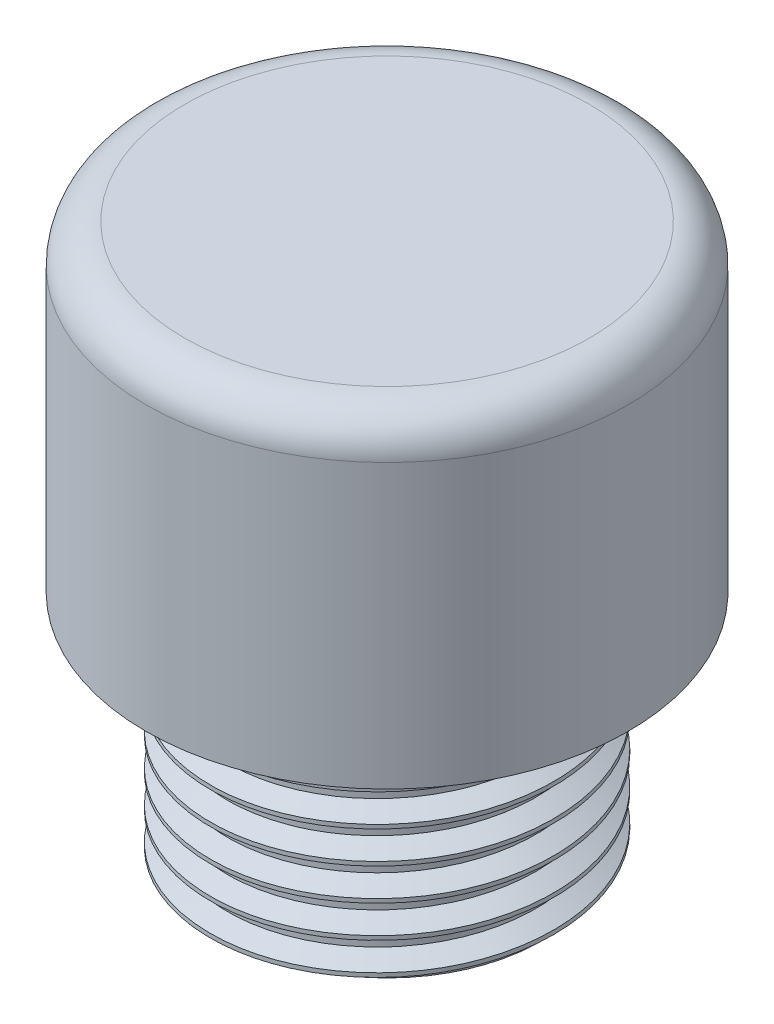
from build123d import *

# Parameters (mm, degrees)
SKETCH1_R           = 9.525
SKETCH1_R_2         = 6.096
SKETCH1_W           = 6.731
SKETCH1_H           = 6.731
BOSS_EXTRUDE1_DEPTH = 12.7
SKETCH1_3_R         = 6.096
SKETCH1_3_W         = 6.731
SKETCH1_3_H         = 6.731
BOSS_EXTRUDE2_DEPTH = 8.89
CUT_EXTRUDE1_START  = 12.192
SKETCH1_5_W         = 6.731
SKETCH1_5_H         = 6.731
CUT_EXTRUDE1_DEPTH  = 6.731
THREAD1_PITCH       = 1.27
THREAD1_FROM        = 6.08
FILLET1_R           = 1.524
SKETCH2_R           = 3.81
CUT_EXTRUDE2_DEPTH  = 8.89
CHAMFER1_SIZE       = 2.54
CHAMFER1_SIZE2      = 3.048


with BuildPart() as part:
    # Sketch1 → Boss-Extrude1 (new body)
    # profile 1 of 3: a face of its own
    with BuildSketch(Plane(origin=(0, 0, 0), x_dir=(1, 0, 0), z_dir=(0, 1, 0))):
        with Locations(Location((0, 0, 0), (0, 0, 270))):
            Circle(SKETCH1_R)
        Circle(SKETCH1_R_2, mode=Mode.SUBTRACT)
    # profile 2 of 3: a face of its own
    with BuildSketch(Plane(origin=(0, 0, 0), x_dir=(1, 0, 0), z_dir=(0, 1, 0))):
        Circle(SKETCH1_R_2)
        Rectangle(SKETCH1_W, SKETCH1_H, mode=Mode.SUBTRACT)
    # profile 3 of 3: a face of its own
    with BuildSketch(Plane(origin=(0, 0, 0), x_dir=(1, 0, 0), z_dir=(0, 1, 0))):
        Rectangle(SKETCH1_W, SKETCH1_H)
    extrude(amount=BOSS_EXTRUDE1_DEPTH)

    # Sketch1<3> → Boss-Extrude2 (add)
    # profile 1 of 2: a face of its own
    with BuildSketch(Plane(origin=(0, 0, 0), x_dir=(1, 0, 0), z_dir=(0, 1, 0))):
        with Locations(Location((0, 0, 0), (0, 0, 270))):
            Circle(SKETCH1_3_R)
        Rectangle(SKETCH1_3_W, SKETCH1_3_H, mode=Mode.SUBTRACT)
    # profile 2 of 2: a face of its own
    with BuildSketch(Plane(origin=(0, 0, 0), x_dir=(1, 0, 0), z_dir=(0, 1, 0))):
        Rectangle(SKETCH1_3_W, SKETCH1_3_H)
    extrude(amount=-BOSS_EXTRUDE2_DEPTH)

    # Sketch1<5> → Cut-Extrude1 (cut)
    with BuildSketch(Plane(origin=(0, 0, 0), x_dir=(1, 0, 0), z_dir=(0, 1, 0)).offset(CUT_EXTRUDE1_START)):
        Rectangle(SKETCH1_5_W, SKETCH1_5_H)
    extrude(amount=-CUT_EXTRUDE1_DEPTH, mode=Mode.SUBTRACT)

    # Thread1: arcs per turn and ends read off the stored shape
    # Thread1: the profile of Thread Profile2 profile screwed along a right-hand helix through 11.787402 turns, 8 arcs to a turn; built about Z, then put on its axis
    thread1_z = Axis((0, 0, 0), (0, 0, 1))
    thread1_corners = [(6.0957, 0, -0.000173205), (6.783407661, 0, 0.396874998), (6.783407661, 0, 0.555624998), (6.0957, 0, 0.952673202)]
    with BuildLine(mode=Mode.PRIVATE) as thread1_profile:
        Line(thread1_corners[0], thread1_corners[1])
        Line(thread1_corners[1], thread1_corners[2])
        Line(thread1_corners[2], thread1_corners[3])
        Line(thread1_corners[3], thread1_corners[0])
    thread1_cap = Face(thread1_profile.wire())
    thread1_turn_angles = [0, 22.5, 45, 67.5, 90, 112.5, 135, 157.5, 180, 202.5, 225, 247.5, 270, 292.5, 315, 337.5, 360]
    thread1_turn_weights = [1, 0.9238795325112867, 1, 0.9238795325112867, 1, 0.9238795325112867, 1, 0.9238795325112867, 1, 0.9238795325112867, 1, 0.9238795325112867, 1, 0.9238795325112867, 1, 0.9238795325112867, 1]
    thread1_turn_rails = [Edge.make_bspline([Vector(p[0], p[1], 0).rotate(thread1_z, thread1_turn_angles[k]) / thread1_turn_weights[k] + Vector(0, 0, p[2] + THREAD1_PITCH * thread1_turn_angles[k] / 360) for k in range(17)], [0, 0, 0, 1, 1, 2, 2, 3, 3, 4, 4, 5, 5, 6, 6, 7, 7, 8, 8, 8], 2, thread1_turn_weights) for p in thread1_corners]
    thread1_turn_sides = [Face.make_surface_from_curves(thread1_turn_rails[p[0]], thread1_turn_rails[p[1]]) for p in [(0, 1), (1, 2), (2, 3), (3, 0)]]
    thread1_last_angles = [3960, 3982.5, 4005, 4027.5, 4050, 4072.5, 4095, 4117.5, 4140, 4162.5, 4185, 4207.5, 4230, 4236.732283465, 4243.464566929]
    thread1_last_weights = [1, 0.9238795325112867, 1, 0.9238795325112867, 1, 0.9238795325112867, 1, 0.9238795325112867, 1, 0.9238795325112867, 1, 0.9238795325112867, 1, 0.9931047534388159, 1]
    thread1_last_rails = [Edge.make_bspline([Vector(p[0], p[1], 0).rotate(thread1_z, thread1_last_angles[k]) / thread1_last_weights[k] + Vector(0, 0, p[2] + THREAD1_PITCH * thread1_last_angles[k] / 360) for k in range(15)], [0, 0, 0, 1, 1, 2, 2, 3, 3, 4, 4, 5, 5, 6, 6, 7, 7, 7], 2, thread1_last_weights) for p in thread1_corners]
    thread1_last_sides = [Face.make_surface_from_curves(thread1_last_rails[p[0]], thread1_last_rails[p[1]]) for p in [(0, 1), (1, 2), (2, 3), (3, 0)]]
    thread1 = Plane(origin=(0, -14.97, 0), x_dir=(1, 0, 0), z_dir=(0, 1, 0)) * split(Solid(Shell([*[p.moved(Location((0, 0, THREAD1_PITCH * i))) for i in range(11) for p in thread1_turn_sides], *thread1_last_sides, thread1_cap, thread1_cap.rotate(thread1_z, 4243.464566929).moved(Location((0, 0, THREAD1_PITCH * 4243.464566929 / 360)))])), bisect_by=Plane.XY.offset(THREAD1_FROM), keep=Keep.TOP, mode=Mode.PRIVATE)
    add(thread1)

    # Fillet1
    fillet1_edges = [part.edges().sort_by_distance(p)[0] for p in [
        (0, 12.7, -9.525),
    ]]
    fillet(fillet1_edges, radius=FILLET1_R)

    # Sketch2 → Cut-Extrude2 (cut)
    with BuildSketch(Plane.XZ):
        with Locations(Location((0, 0, 0), (0, 0, 90))):
            Circle(SKETCH2_R)
    extrude(amount=CUT_EXTRUDE2_DEPTH, mode=Mode.SUBTRACT)

    # Chamfer1
    chamfer1_edges = [part.edges().sort_by_distance(p)[0] for p in [
        (0, 0, -3.81),
    ]]
    chamfer1_side = [part.faces().sort_by_distance(p)[0] for p in [
        (0, -4.445, -3.81),
    ]]
    chamfer(chamfer1_edges, length=CHAMFER1_SIZE, length2=CHAMFER1_SIZE2, reference=chamfer1_side[0])


solid = part.part
